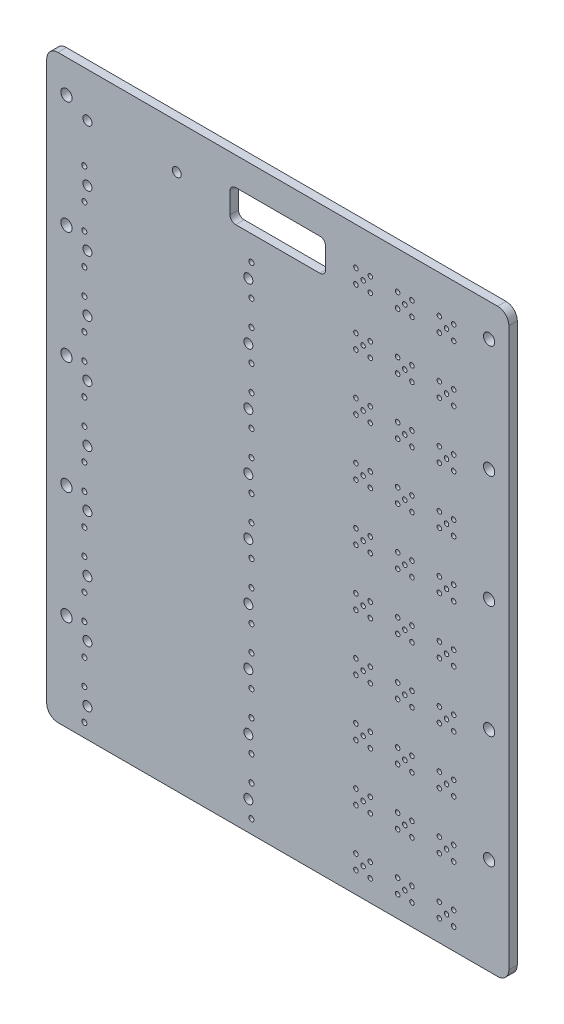
from build123d import *

# Parameters (mm, degrees)
SKETCH2_W                          = 82
SKETCH2_H                          = 103
MAINBOARD_DEPTH                    = 1.5
SKETCH3_W                          = 16.95
SKETCH3_H                          = 5.7
SOLARHOLE_DEPTH                    = 132.663396584
FILLET1_R                          = 2
FILLET2_R                          = 1
F_1_6MM_HOLE_20PIN_D               = 1.6
F_1_6MM_HOLE_20PIN_DEPTH           = 9.525
F_1_6MM_HOLE_20PIN_TIP             = 0.480688495
F_1_6MM_HOLE_40PN_BIG_AT_2_COUNT   = 2
F_1_6MM_HOLE_40PN_BIG_AT_2_PITCH   = 28.55
F_0_9MM_HOLE_40PIN_TINY_AT_2_COUNT = 2
F_0_9MM_HOLE_40PIN_TINY_AT_2_PITCH = 5.5
F_0_9MM_HOLE_40PIN_TINY_AT_3_COUNT = 2
F_0_9MM_HOLE_40PIN_TINY_AT_3_PITCH = 29.65
F_0_9MM_HOLE_40PIN_TINY_AT_4_COUNT = 2
F_0_9MM_HOLE_40PIN_TINY_AT_4_PITCH = 30.155803753
F_0_8MM_MMCX_HOLE_AT_2_COUNT       = 2
F_0_8MM_MMCX_HOLE_AT_2_PITCH       = 1.796051224
F_0_8MM_MMCX_HOLE_AT_3_COUNT       = 2
F_0_8MM_MMCX_HOLE_AT_3_PITCH       = 1.796051224
F_0_8MM_MMCX_HOLE_AT_4_COUNT       = 2
F_0_8MM_MMCX_HOLE_AT_4_PITCH       = 1.796051224
F_0_8MM_MMCX_HOLE_AT_5_COUNT       = 2
F_0_8MM_MMCX_HOLE_AT_5_PITCH       = 1.796051224
MMCX_INTRA_CARD_COUNT              = 3
MMCX_INTRA_CARD_PITCH              = 7.4
ZPOS_BLOCK_COUNT                   = 9
ZPOS_BLOCK_PITCH                   = 10
SCREWHOLES_INTRA_RAIL_COUNT        = 5
SCREWHOLES_INTRA_RAIL_PITCH        = 20


with BuildPart() as part:
    # Sketch2 → mainBoard (new body)
    with BuildSketch(Plane.XY):
        with Locations((41, 51.5)):
            Rectangle(SKETCH2_W, SKETCH2_H)
    extrude(amount=MAINBOARD_DEPTH)

    # Sketch3 → solarHole (cut, through all)
    with BuildSketch(Plane.XY.offset(1.5)):
        with Locations((41, 95.15)):
            Rectangle(SKETCH3_W, SKETCH3_H)
    extrude(amount=-SOLARHOLE_DEPTH, mode=Mode.SUBTRACT)

    # Fillet1
    fillet1_edges = [part.edges().sort_by_distance(p)[0] for p in [
        (0, 0, 0.75),
        (82, 0, 0.75),
        (82, 103, 0.75),
        (0, 103, 0.75),
    ]]
    fillet(fillet1_edges, radius=FILLET1_R)

    # Fillet2
    fillet2_edges = [part.edges().sort_by_distance(p)[0] for p in [
        (49.475, 92.3, 0.75),
        (49.475, 98, 0.75),
        (32.525, 92.3, 0.75),
        (32.525, 98, 0.75),
    ]]
    fillet(fillet2_edges, radius=FILLET2_R)

    # Sketch5 → Ø2.0mm Hole_screw (revolve, cut)
    with BuildSketch(Plane(origin=(3.5, 97.2, 1.5), x_dir=(0, -1, 0), z_dir=(1, 0, 0))):
        Polygon((0, 0), (0, 10.125860619), (1, 9.525), (1, 0), align=None)
    f_2_0mm_hole_screw = revolve(axis=Axis((3.5, 97.2, 7.85), (0, 0, -1)), mode=Mode.SUBTRACT)

    # Ø1.6mm Hole_20pin
    with Locations(Plane.XY.offset(1.5)):
        with Locations((7.225, 95.15), (23.075, 95.15)):
            Hole(F_1_6MM_HOLE_20PIN_D / 2, depth=F_1_6MM_HOLE_20PIN_DEPTH)
            with Locations((0, 0, -(F_1_6MM_HOLE_20PIN_DEPTH + F_1_6MM_HOLE_20PIN_TIP / 2))):  # 118° drill point
                Cone(0, F_1_6MM_HOLE_20PIN_D / 2, F_1_6MM_HOLE_20PIN_TIP, mode=Mode.SUBTRACT)

    # Sketch7 → Ø1.6mm Hole_40pn_big (revolve, cut)
    with BuildSketch(Plane(origin=(7.225, 85.15, 1.5), x_dir=(0, -1, 0), z_dir=(1, 0, 0))):
        Polygon((0, 0), (0, 10.005688495), (0.8, 9.525), (0.8, 0), align=None)
    f_1_6mm_hole_40pn_big = revolve(axis=Axis((7.225, 85.15, 7.85), (0, 0, -1)), mode=Mode.SUBTRACT)

    # Ø1.6mm Hole_40pn_big at 2: Ø1.6mm Hole_40pn_big ×2
    with Locations(*[(i * F_1_6MM_HOLE_40PN_BIG_AT_2_PITCH, 0, 0) for i in range(1, F_1_6MM_HOLE_40PN_BIG_AT_2_COUNT)]):
        add(f_1_6mm_hole_40pn_big, mode=Mode.SUBTRACT)

    # Sketch11 → Ø0.9mm Hole_40pin_tiny (revolve, cut)
    with BuildSketch(Plane(origin=(6.675, 87.9, 1.5), x_dir=(0, -1, 0), z_dir=(1, 0, 0))):
        Polygon((0, 0), (0, 9.795387279), (0.45, 9.525), (0.45, 0), align=None)
    f_0_9mm_hole_40pin_tiny = revolve(axis=Axis((6.675, 87.9, 7.85), (0, 0, -1)), mode=Mode.SUBTRACT)

    # Ø0.9mm Hole_40pin_tiny at 2: Ø0.9mm Hole_40pin_tiny ×2
    with Locations(*[(0, -i * F_0_9MM_HOLE_40PIN_TINY_AT_2_PITCH, 0) for i in range(1, F_0_9MM_HOLE_40PIN_TINY_AT_2_COUNT)]):
        add(f_0_9mm_hole_40pin_tiny, mode=Mode.SUBTRACT)

    # Ø0.9mm Hole_40pin_tiny at 3: Ø0.9mm Hole_40pin_tiny ×2
    with Locations(*[(i * F_0_9MM_HOLE_40PIN_TINY_AT_3_PITCH, 0, 0) for i in range(1, F_0_9MM_HOLE_40PIN_TINY_AT_3_COUNT)]):
        add(f_0_9mm_hole_40pin_tiny, mode=Mode.SUBTRACT)

    # Ø0.9mm Hole_40pin_tiny at 4: Ø0.9mm Hole_40pin_tiny ×2
    with Locations(*[Vector(0.9832269848512432, -0.18238611860646994, 0) * (i * F_0_9MM_HOLE_40PIN_TINY_AT_4_PITCH) for i in range(1, F_0_9MM_HOLE_40PIN_TINY_AT_4_COUNT)]):
        add(f_0_9mm_hole_40pin_tiny, mode=Mode.SUBTRACT)

    # Sketch9 → Ø0.8mm MMCX Hole (revolve, cut)
    with BuildSketch(Plane(origin=(70.94, 85.05, 1.5), x_dir=(0, -1, 0), z_dir=(1, 0, 0))):
        Polygon((0, 0), (0, 9.765344248), (0.4, 9.525), (0.4, 0), align=None)
    f_0_8mm_mmcx_hole = revolve(axis=Axis((70.94, 85.05, 7.85), (0, 0, -1)), mode=Mode.SUBTRACT)

    # Ø0.8mm MMCX Hole at 2: Ø0.8mm MMCX Hole ×2
    with Locations(*[Vector(-0.7071067811865436, 0.7071067811865515, 0) * (i * F_0_8MM_MMCX_HOLE_AT_2_PITCH) for i in range(1, F_0_8MM_MMCX_HOLE_AT_2_COUNT)]):
        add(f_0_8mm_mmcx_hole, mode=Mode.SUBTRACT)

    # Ø0.8mm MMCX Hole at 3: Ø0.8mm MMCX Hole ×2
    with Locations(*[Vector(0.7071067811865476, 0.7071067811865476, 0) * (i * F_0_8MM_MMCX_HOLE_AT_3_PITCH) for i in range(1, F_0_8MM_MMCX_HOLE_AT_3_COUNT)]):
        add(f_0_8mm_mmcx_hole, mode=Mode.SUBTRACT)

    # Ø0.8mm MMCX Hole at 4: Ø0.8mm MMCX Hole ×2
    with Locations(*[Vector(0.7071067811865515, -0.7071067811865436, 0) * (i * F_0_8MM_MMCX_HOLE_AT_4_PITCH) for i in range(1, F_0_8MM_MMCX_HOLE_AT_4_COUNT)]):
        add(f_0_8mm_mmcx_hole, mode=Mode.SUBTRACT)

    # Ø0.8mm MMCX Hole at 5: Ø0.8mm MMCX Hole ×2
    with Locations(*[Vector(-0.7071067811865476, -0.7071067811865476, 0) * (i * F_0_8MM_MMCX_HOLE_AT_5_PITCH) for i in range(1, F_0_8MM_MMCX_HOLE_AT_5_COUNT)]):
        add(f_0_8mm_mmcx_hole, mode=Mode.SUBTRACT)

    # MMCX_intra-card: Ø0.8mm MMCX Hole ×3
    with Locations(*[(-i * MMCX_INTRA_CARD_PITCH, 0, 0) for i in range(1, MMCX_INTRA_CARD_COUNT)]):
        add(f_0_8mm_mmcx_hole, mode=Mode.SUBTRACT)

    # MMCX_intra-card copy 1 sketch → MMCX_intra-card copy 1 (revolve, cut)
    with BuildSketch(Plane(origin=(62.27, 86.32, 1.5), x_dir=(0, -1, 0), z_dir=(1, 0, 0))):
        Polygon((0, 0), (0, 9.765344248), (0.4, 9.525), (0.4, 0), align=None)
    revolve(axis=Axis((62.27, 86.32, 7.85), (0, 0, -1)), mode=Mode.SUBTRACT)

    # MMCX_intra-card copy 2 sketch → MMCX_intra-card copy 2 (revolve, cut)
    with BuildSketch(Plane(origin=(54.87, 86.32, 1.5), x_dir=(0, -1, 0), z_dir=(1, 0, 0))):
        Polygon((0, 0), (0, 9.765344248), (0.4, 9.525), (0.4, 0), align=None)
    revolve(axis=Axis((54.87, 86.32, 7.85), (0, 0, -1)), mode=Mode.SUBTRACT)

    # MMCX_intra-card copy 3 sketch → MMCX_intra-card copy 3 (revolve, cut)
    with BuildSketch(Plane(origin=(64.81, 86.32, 1.5), x_dir=(0, -1, 0), z_dir=(1, 0, 0))):
        Polygon((0, 0), (0, 9.765344248), (0.4, 9.525), (0.4, 0), align=None)
    revolve(axis=Axis((64.81, 86.32, 7.85), (0, 0, -1)), mode=Mode.SUBTRACT)

    # MMCX_intra-card copy 4 sketch → MMCX_intra-card copy 4 (revolve, cut)
    with BuildSketch(Plane(origin=(57.41, 86.32, 1.5), x_dir=(0, -1, 0), z_dir=(1, 0, 0))):
        Polygon((0, 0), (0, 9.765344248), (0.4, 9.525), (0.4, 0), align=None)
    revolve(axis=Axis((57.41, 86.32, 7.85), (0, 0, -1)), mode=Mode.SUBTRACT)

    # MMCX_intra-card copy 5 sketch → MMCX_intra-card copy 5 (revolve, cut)
    with BuildSketch(Plane(origin=(64.81, 83.78, 1.5), x_dir=(0, -1, 0), z_dir=(1, 0, 0))):
        Polygon((0, 0), (0, 9.765344248), (0.4, 9.525), (0.4, 0), align=None)
    revolve(axis=Axis((64.81, 83.78, 7.85), (0, 0, -1)), mode=Mode.SUBTRACT)

    # MMCX_intra-card copy 6 sketch → MMCX_intra-card copy 6 (revolve, cut)
    with BuildSketch(Plane(origin=(57.41, 83.78, 1.5), x_dir=(0, -1, 0), z_dir=(1, 0, 0))):
        Polygon((0, 0), (0, 9.765344248), (0.4, 9.525), (0.4, 0), align=None)
    revolve(axis=Axis((57.41, 83.78, 7.85), (0, 0, -1)), mode=Mode.SUBTRACT)

    # MMCX_intra-card copy 7 sketch → MMCX_intra-card copy 7 (revolve, cut)
    with BuildSketch(Plane(origin=(62.27, 83.78, 1.5), x_dir=(0, -1, 0), z_dir=(1, 0, 0))):
        Polygon((0, 0), (0, 9.765344248), (0.4, 9.525), (0.4, 0), align=None)
    revolve(axis=Axis((62.27, 83.78, 7.85), (0, 0, -1)), mode=Mode.SUBTRACT)

    # MMCX_intra-card copy 8 sketch → MMCX_intra-card copy 8 (revolve, cut)
    with BuildSketch(Plane(origin=(54.87, 83.78, 1.5), x_dir=(0, -1, 0), z_dir=(1, 0, 0))):
        Polygon((0, 0), (0, 9.765344248), (0.4, 9.525), (0.4, 0), align=None)
    revolve(axis=Axis((54.87, 83.78, 7.85), (0, 0, -1)), mode=Mode.SUBTRACT)

    # Zpos_block: Ø1.6mm Hole_40pn_big, Ø0.9mm Hole_40pin_tiny ×9
    with Locations(*[(0, -i * ZPOS_BLOCK_PITCH, 0) for i in range(1, ZPOS_BLOCK_COUNT)]):
        add(f_1_6mm_hole_40pn_big, mode=Mode.SUBTRACT)
        add(f_0_9mm_hole_40pin_tiny, mode=Mode.SUBTRACT)

    # Zpos_block copy 1 sketch → Zpos_block copy 1 (revolve, cut)
    with BuildSketch(Plane(origin=(35.775, 75.15, 1.5), x_dir=(0, -1, 0), z_dir=(1, 0, 0))):
        Polygon((0, 0), (0, 10.005688495), (0.8, 9.525), (0.8, 0), align=None)
    revolve(axis=Axis((35.775, 75.15, 7.85), (0, 0, -1)), mode=Mode.SUBTRACT)

    # Zpos_block copy 2 sketch → Zpos_block copy 2 (revolve, cut)
    with BuildSketch(Plane(origin=(35.775, 65.15, 1.5), x_dir=(0, -1, 0), z_dir=(1, 0, 0))):
        Polygon((0, 0), (0, 10.005688495), (0.8, 9.525), (0.8, 0), align=None)
    revolve(axis=Axis((35.775, 65.15, 7.85), (0, 0, -1)), mode=Mode.SUBTRACT)

    # Zpos_block copy 3 sketch → Zpos_block copy 3 (revolve, cut)
    with BuildSketch(Plane(origin=(35.775, 55.15, 1.5), x_dir=(0, -1, 0), z_dir=(1, 0, 0))):
        Polygon((0, 0), (0, 10.005688495), (0.8, 9.525), (0.8, 0), align=None)
    revolve(axis=Axis((35.775, 55.15, 7.85), (0, 0, -1)), mode=Mode.SUBTRACT)

    # Zpos_block copy 4 sketch → Zpos_block copy 4 (revolve, cut)
    with BuildSketch(Plane(origin=(35.775, 45.15, 1.5), x_dir=(0, -1, 0), z_dir=(1, 0, 0))):
        Polygon((0, 0), (0, 10.005688495), (0.8, 9.525), (0.8, 0), align=None)
    revolve(axis=Axis((35.775, 45.15, 7.85), (0, 0, -1)), mode=Mode.SUBTRACT)

    # Zpos_block copy 5 sketch → Zpos_block copy 5 (revolve, cut)
    with BuildSketch(Plane(origin=(35.775, 35.15, 1.5), x_dir=(0, -1, 0), z_dir=(1, 0, 0))):
        Polygon((0, 0), (0, 10.005688495), (0.8, 9.525), (0.8, 0), align=None)
    revolve(axis=Axis((35.775, 35.15, 7.85), (0, 0, -1)), mode=Mode.SUBTRACT)

    # Zpos_block copy 6 sketch → Zpos_block copy 6 (revolve, cut)
    with BuildSketch(Plane(origin=(35.775, 25.15, 1.5), x_dir=(0, -1, 0), z_dir=(1, 0, 0))):
        Polygon((0, 0), (0, 10.005688495), (0.8, 9.525), (0.8, 0), align=None)
    revolve(axis=Axis((35.775, 25.15, 7.85), (0, 0, -1)), mode=Mode.SUBTRACT)

    # Zpos_block copy 7 sketch → Zpos_block copy 7 (revolve, cut)
    with BuildSketch(Plane(origin=(35.775, 15.15, 1.5), x_dir=(0, -1, 0), z_dir=(1, 0, 0))):
        Polygon((0, 0), (0, 10.005688495), (0.8, 9.525), (0.8, 0), align=None)
    revolve(axis=Axis((35.775, 15.15, 7.85), (0, 0, -1)), mode=Mode.SUBTRACT)

    # Zpos_block copy 8 sketch → Zpos_block copy 8 (revolve, cut)
    with BuildSketch(Plane(origin=(35.775, 5.15, 1.5), x_dir=(0, -1, 0), z_dir=(1, 0, 0))):
        Polygon((0, 0), (0, 10.005688495), (0.8, 9.525), (0.8, 0), align=None)
    revolve(axis=Axis((35.775, 5.15, 7.85), (0, 0, -1)), mode=Mode.SUBTRACT)

    # Zpos_block copy 9 sketch → Zpos_block copy 9 (revolve, cut)
    with BuildSketch(Plane(origin=(6.675, 72.4, 1.5), x_dir=(0, -1, 0), z_dir=(1, 0, 0))):
        Polygon((0, 0), (0, 9.795387279), (0.45, 9.525), (0.45, 0), align=None)
    revolve(axis=Axis((6.675, 72.4, 7.85), (0, 0, -1)), mode=Mode.SUBTRACT)

    # Zpos_block copy 10 sketch → Zpos_block copy 10 (revolve, cut)
    with BuildSketch(Plane(origin=(6.675, 62.4, 1.5), x_dir=(0, -1, 0), z_dir=(1, 0, 0))):
        Polygon((0, 0), (0, 9.795387279), (0.45, 9.525), (0.45, 0), align=None)
    revolve(axis=Axis((6.675, 62.4, 7.85), (0, 0, -1)), mode=Mode.SUBTRACT)

    # Zpos_block copy 11 sketch → Zpos_block copy 11 (revolve, cut)
    with BuildSketch(Plane(origin=(6.675, 52.4, 1.5), x_dir=(0, -1, 0), z_dir=(1, 0, 0))):
        Polygon((0, 0), (0, 9.795387279), (0.45, 9.525), (0.45, 0), align=None)
    revolve(axis=Axis((6.675, 52.4, 7.85), (0, 0, -1)), mode=Mode.SUBTRACT)

    # Zpos_block copy 12 sketch → Zpos_block copy 12 (revolve, cut)
    with BuildSketch(Plane(origin=(6.675, 42.4, 1.5), x_dir=(0, -1, 0), z_dir=(1, 0, 0))):
        Polygon((0, 0), (0, 9.795387279), (0.45, 9.525), (0.45, 0), align=None)
    revolve(axis=Axis((6.675, 42.4, 7.85), (0, 0, -1)), mode=Mode.SUBTRACT)

    # Zpos_block copy 13 sketch → Zpos_block copy 13 (revolve, cut)
    with BuildSketch(Plane(origin=(6.675, 32.4, 1.5), x_dir=(0, -1, 0), z_dir=(1, 0, 0))):
        Polygon((0, 0), (0, 9.795387279), (0.45, 9.525), (0.45, 0), align=None)
    revolve(axis=Axis((6.675, 32.4, 7.85), (0, 0, -1)), mode=Mode.SUBTRACT)

    # Zpos_block copy 14 sketch → Zpos_block copy 14 (revolve, cut)
    with BuildSketch(Plane(origin=(6.675, 22.4, 1.5), x_dir=(0, -1, 0), z_dir=(1, 0, 0))):
        Polygon((0, 0), (0, 9.795387279), (0.45, 9.525), (0.45, 0), align=None)
    revolve(axis=Axis((6.675, 22.4, 7.85), (0, 0, -1)), mode=Mode.SUBTRACT)

    # Zpos_block copy 15 sketch → Zpos_block copy 15 (revolve, cut)
    with BuildSketch(Plane(origin=(6.675, 12.4, 1.5), x_dir=(0, -1, 0), z_dir=(1, 0, 0))):
        Polygon((0, 0), (0, 9.795387279), (0.45, 9.525), (0.45, 0), align=None)
    revolve(axis=Axis((6.675, 12.4, 7.85), (0, 0, -1)), mode=Mode.SUBTRACT)

    # Zpos_block copy 16 sketch → Zpos_block copy 16 (revolve, cut)
    with BuildSketch(Plane(origin=(6.675, 2.4, 1.5), x_dir=(0, -1, 0), z_dir=(1, 0, 0))):
        Polygon((0, 0), (0, 9.795387279), (0.45, 9.525), (0.45, 0), align=None)
    revolve(axis=Axis((6.675, 2.4, 7.85), (0, 0, -1)), mode=Mode.SUBTRACT)

    # Zpos_block copy 17 sketch → Zpos_block copy 17 (revolve, cut)
    with BuildSketch(Plane(origin=(36.325, 77.9, 1.5), x_dir=(0, -1, 0), z_dir=(1, 0, 0))):
        Polygon((0, 0), (0, 9.795387279), (0.45, 9.525), (0.45, 0), align=None)
    revolve(axis=Axis((36.325, 77.9, 7.85), (0, 0, -1)), mode=Mode.SUBTRACT)

    # Zpos_block copy 18 sketch → Zpos_block copy 18 (revolve, cut)
    with BuildSketch(Plane(origin=(36.325, 67.9, 1.5), x_dir=(0, -1, 0), z_dir=(1, 0, 0))):
        Polygon((0, 0), (0, 9.795387279), (0.45, 9.525), (0.45, 0), align=None)
    revolve(axis=Axis((36.325, 67.9, 7.85), (0, 0, -1)), mode=Mode.SUBTRACT)

    # Zpos_block copy 19 sketch → Zpos_block copy 19 (revolve, cut)
    with BuildSketch(Plane(origin=(36.325, 57.9, 1.5), x_dir=(0, -1, 0), z_dir=(1, 0, 0))):
        Polygon((0, 0), (0, 9.795387279), (0.45, 9.525), (0.45, 0), align=None)
    revolve(axis=Axis((36.325, 57.9, 7.85), (0, 0, -1)), mode=Mode.SUBTRACT)

    # Zpos_block copy 20 sketch → Zpos_block copy 20 (revolve, cut)
    with BuildSketch(Plane(origin=(36.325, 47.9, 1.5), x_dir=(0, -1, 0), z_dir=(1, 0, 0))):
        Polygon((0, 0), (0, 9.795387279), (0.45, 9.525), (0.45, 0), align=None)
    revolve(axis=Axis((36.325, 47.9, 7.85), (0, 0, -1)), mode=Mode.SUBTRACT)

    # Zpos_block copy 21 sketch → Zpos_block copy 21 (revolve, cut)
    with BuildSketch(Plane(origin=(36.325, 37.9, 1.5), x_dir=(0, -1, 0), z_dir=(1, 0, 0))):
        Polygon((0, 0), (0, 9.795387279), (0.45, 9.525), (0.45, 0), align=None)
    revolve(axis=Axis((36.325, 37.9, 7.85), (0, 0, -1)), mode=Mode.SUBTRACT)

    # Zpos_block copy 22 sketch → Zpos_block copy 22 (revolve, cut)
    with BuildSketch(Plane(origin=(36.325, 27.9, 1.5), x_dir=(0, -1, 0), z_dir=(1, 0, 0))):
        Polygon((0, 0), (0, 9.795387279), (0.45, 9.525), (0.45, 0), align=None)
    revolve(axis=Axis((36.325, 27.9, 7.85), (0, 0, -1)), mode=Mode.SUBTRACT)

    # Zpos_block copy 23 sketch → Zpos_block copy 23 (revolve, cut)
    with BuildSketch(Plane(origin=(36.325, 17.9, 1.5), x_dir=(0, -1, 0), z_dir=(1, 0, 0))):
        Polygon((0, 0), (0, 9.795387279), (0.45, 9.525), (0.45, 0), align=None)
    revolve(axis=Axis((36.325, 17.9, 7.85), (0, 0, -1)), mode=Mode.SUBTRACT)

    # Zpos_block copy 24 sketch → Zpos_block copy 24 (revolve, cut)
    with BuildSketch(Plane(origin=(36.325, 7.9, 1.5), x_dir=(0, -1, 0), z_dir=(1, 0, 0))):
        Polygon((0, 0), (0, 9.795387279), (0.45, 9.525), (0.45, 0), align=None)
    revolve(axis=Axis((36.325, 7.9, 7.85), (0, 0, -1)), mode=Mode.SUBTRACT)

    # Zpos_block copy 25 sketch → Zpos_block copy 25 (revolve, cut)
    with BuildSketch(Plane(origin=(36.325, 72.4, 1.5), x_dir=(0, -1, 0), z_dir=(1, 0, 0))):
        Polygon((0, 0), (0, 9.795387279), (0.45, 9.525), (0.45, 0), align=None)
    revolve(axis=Axis((36.325, 72.4, 7.85), (0, 0, -1)), mode=Mode.SUBTRACT)

    # Zpos_block copy 26 sketch → Zpos_block copy 26 (revolve, cut)
    with BuildSketch(Plane(origin=(36.325, 62.4, 1.5), x_dir=(0, -1, 0), z_dir=(1, 0, 0))):
        Polygon((0, 0), (0, 9.795387279), (0.45, 9.525), (0.45, 0), align=None)
    revolve(axis=Axis((36.325, 62.4, 7.85), (0, 0, -1)), mode=Mode.SUBTRACT)

    # Zpos_block copy 27 sketch → Zpos_block copy 27 (revolve, cut)
    with BuildSketch(Plane(origin=(36.325, 52.4, 1.5), x_dir=(0, -1, 0), z_dir=(1, 0, 0))):
        Polygon((0, 0), (0, 9.795387279), (0.45, 9.525), (0.45, 0), align=None)
    revolve(axis=Axis((36.325, 52.4, 7.85), (0, 0, -1)), mode=Mode.SUBTRACT)

    # Zpos_block copy 28 sketch → Zpos_block copy 28 (revolve, cut)
    with BuildSketch(Plane(origin=(36.325, 42.4, 1.5), x_dir=(0, -1, 0), z_dir=(1, 0, 0))):
        Polygon((0, 0), (0, 9.795387279), (0.45, 9.525), (0.45, 0), align=None)
    revolve(axis=Axis((36.325, 42.4, 7.85), (0, 0, -1)), mode=Mode.SUBTRACT)

    # Zpos_block copy 29 sketch → Zpos_block copy 29 (revolve, cut)
    with BuildSketch(Plane(origin=(36.325, 32.4, 1.5), x_dir=(0, -1, 0), z_dir=(1, 0, 0))):
        Polygon((0, 0), (0, 9.795387279), (0.45, 9.525), (0.45, 0), align=None)
    revolve(axis=Axis((36.325, 32.4, 7.85), (0, 0, -1)), mode=Mode.SUBTRACT)

    # Zpos_block copy 30 sketch → Zpos_block copy 30 (revolve, cut)
    with BuildSketch(Plane(origin=(36.325, 22.4, 1.5), x_dir=(0, -1, 0), z_dir=(1, 0, 0))):
        Polygon((0, 0), (0, 9.795387279), (0.45, 9.525), (0.45, 0), align=None)
    revolve(axis=Axis((36.325, 22.4, 7.85), (0, 0, -1)), mode=Mode.SUBTRACT)

    # Zpos_block copy 31 sketch → Zpos_block copy 31 (revolve, cut)
    with BuildSketch(Plane(origin=(36.325, 12.4, 1.5), x_dir=(0, -1, 0), z_dir=(1, 0, 0))):
        Polygon((0, 0), (0, 9.795387279), (0.45, 9.525), (0.45, 0), align=None)
    revolve(axis=Axis((36.325, 12.4, 7.85), (0, 0, -1)), mode=Mode.SUBTRACT)

    # Zpos_block copy 32 sketch → Zpos_block copy 32 (revolve, cut)
    with BuildSketch(Plane(origin=(36.325, 2.4, 1.5), x_dir=(0, -1, 0), z_dir=(1, 0, 0))):
        Polygon((0, 0), (0, 9.795387279), (0.45, 9.525), (0.45, 0), align=None)
    revolve(axis=Axis((36.325, 2.4, 7.85), (0, 0, -1)), mode=Mode.SUBTRACT)

    # Zpos_block copy 33 sketch → Zpos_block copy 33 (revolve, cut)
    with BuildSketch(Plane(origin=(63.54, 75.05, 1.5), x_dir=(0, -1, 0), z_dir=(1, 0, 0))):
        Polygon((0, 0), (0, 9.765344248), (0.4, 9.525), (0.4, 0), align=None)
    revolve(axis=Axis((63.54, 75.05, 7.85), (0, 0, -1)), mode=Mode.SUBTRACT)

    # Zpos_block copy 34 sketch → Zpos_block copy 34 (revolve, cut)
    with BuildSketch(Plane(origin=(63.54, 65.05, 1.5), x_dir=(0, -1, 0), z_dir=(1, 0, 0))):
        Polygon((0, 0), (0, 9.765344248), (0.4, 9.525), (0.4, 0), align=None)
    revolve(axis=Axis((63.54, 65.05, 7.85), (0, 0, -1)), mode=Mode.SUBTRACT)

    # Zpos_block copy 35 sketch → Zpos_block copy 35 (revolve, cut)
    with BuildSketch(Plane(origin=(63.54, 55.05, 1.5), x_dir=(0, -1, 0), z_dir=(1, 0, 0))):
        Polygon((0, 0), (0, 9.765344248), (0.4, 9.525), (0.4, 0), align=None)
    revolve(axis=Axis((63.54, 55.05, 7.85), (0, 0, -1)), mode=Mode.SUBTRACT)

    # Zpos_block copy 36 sketch → Zpos_block copy 36 (revolve, cut)
    with BuildSketch(Plane(origin=(63.54, 45.05, 1.5), x_dir=(0, -1, 0), z_dir=(1, 0, 0))):
        Polygon((0, 0), (0, 9.765344248), (0.4, 9.525), (0.4, 0), align=None)
    revolve(axis=Axis((63.54, 45.05, 7.85), (0, 0, -1)), mode=Mode.SUBTRACT)

    # Zpos_block copy 37 sketch → Zpos_block copy 37 (revolve, cut)
    with BuildSketch(Plane(origin=(63.54, 35.05, 1.5), x_dir=(0, -1, 0), z_dir=(1, 0, 0))):
        Polygon((0, 0), (0, 9.765344248), (0.4, 9.525), (0.4, 0), align=None)
    revolve(axis=Axis((63.54, 35.05, 7.85), (0, 0, -1)), mode=Mode.SUBTRACT)

    # Zpos_block copy 38 sketch → Zpos_block copy 38 (revolve, cut)
    with BuildSketch(Plane(origin=(63.54, 25.05, 1.5), x_dir=(0, -1, 0), z_dir=(1, 0, 0))):
        Polygon((0, 0), (0, 9.765344248), (0.4, 9.525), (0.4, 0), align=None)
    revolve(axis=Axis((63.54, 25.05, 7.85), (0, 0, -1)), mode=Mode.SUBTRACT)

    # Zpos_block copy 39 sketch → Zpos_block copy 39 (revolve, cut)
    with BuildSketch(Plane(origin=(63.54, 15.05, 1.5), x_dir=(0, -1, 0), z_dir=(1, 0, 0))):
        Polygon((0, 0), (0, 9.765344248), (0.4, 9.525), (0.4, 0), align=None)
    revolve(axis=Axis((63.54, 15.05, 7.85), (0, 0, -1)), mode=Mode.SUBTRACT)

    # Zpos_block copy 40 sketch → Zpos_block copy 40 (revolve, cut)
    with BuildSketch(Plane(origin=(63.54, 5.05, 1.5), x_dir=(0, -1, 0), z_dir=(1, 0, 0))):
        Polygon((0, 0), (0, 9.765344248), (0.4, 9.525), (0.4, 0), align=None)
    revolve(axis=Axis((63.54, 5.05, 7.85), (0, 0, -1)), mode=Mode.SUBTRACT)

    # Zpos_block copy 41 sketch → Zpos_block copy 41 (revolve, cut)
    with BuildSketch(Plane(origin=(56.14, 75.05, 1.5), x_dir=(0, -1, 0), z_dir=(1, 0, 0))):
        Polygon((0, 0), (0, 9.765344248), (0.4, 9.525), (0.4, 0), align=None)
    revolve(axis=Axis((56.14, 75.05, 7.85), (0, 0, -1)), mode=Mode.SUBTRACT)

    # Zpos_block copy 42 sketch → Zpos_block copy 42 (revolve, cut)
    with BuildSketch(Plane(origin=(56.14, 65.05, 1.5), x_dir=(0, -1, 0), z_dir=(1, 0, 0))):
        Polygon((0, 0), (0, 9.765344248), (0.4, 9.525), (0.4, 0), align=None)
    revolve(axis=Axis((56.14, 65.05, 7.85), (0, 0, -1)), mode=Mode.SUBTRACT)

    # Zpos_block copy 43 sketch → Zpos_block copy 43 (revolve, cut)
    with BuildSketch(Plane(origin=(56.14, 55.05, 1.5), x_dir=(0, -1, 0), z_dir=(1, 0, 0))):
        Polygon((0, 0), (0, 9.765344248), (0.4, 9.525), (0.4, 0), align=None)
    revolve(axis=Axis((56.14, 55.05, 7.85), (0, 0, -1)), mode=Mode.SUBTRACT)

    # Zpos_block copy 44 sketch → Zpos_block copy 44 (revolve, cut)
    with BuildSketch(Plane(origin=(56.14, 45.05, 1.5), x_dir=(0, -1, 0), z_dir=(1, 0, 0))):
        Polygon((0, 0), (0, 9.765344248), (0.4, 9.525), (0.4, 0), align=None)
    revolve(axis=Axis((56.14, 45.05, 7.85), (0, 0, -1)), mode=Mode.SUBTRACT)

    # Zpos_block copy 45 sketch → Zpos_block copy 45 (revolve, cut)
    with BuildSketch(Plane(origin=(56.14, 35.05, 1.5), x_dir=(0, -1, 0), z_dir=(1, 0, 0))):
        Polygon((0, 0), (0, 9.765344248), (0.4, 9.525), (0.4, 0), align=None)
    revolve(axis=Axis((56.14, 35.05, 7.85), (0, 0, -1)), mode=Mode.SUBTRACT)

    # Zpos_block copy 46 sketch → Zpos_block copy 46 (revolve, cut)
    with BuildSketch(Plane(origin=(56.14, 25.05, 1.5), x_dir=(0, -1, 0), z_dir=(1, 0, 0))):
        Polygon((0, 0), (0, 9.765344248), (0.4, 9.525), (0.4, 0), align=None)
    revolve(axis=Axis((56.14, 25.05, 7.85), (0, 0, -1)), mode=Mode.SUBTRACT)

    # Zpos_block copy 47 sketch → Zpos_block copy 47 (revolve, cut)
    with BuildSketch(Plane(origin=(56.14, 15.05, 1.5), x_dir=(0, -1, 0), z_dir=(1, 0, 0))):
        Polygon((0, 0), (0, 9.765344248), (0.4, 9.525), (0.4, 0), align=None)
    revolve(axis=Axis((56.14, 15.05, 7.85), (0, 0, -1)), mode=Mode.SUBTRACT)

    # Zpos_block copy 48 sketch → Zpos_block copy 48 (revolve, cut)
    with BuildSketch(Plane(origin=(56.14, 5.05, 1.5), x_dir=(0, -1, 0), z_dir=(1, 0, 0))):
        Polygon((0, 0), (0, 9.765344248), (0.4, 9.525), (0.4, 0), align=None)
    revolve(axis=Axis((56.14, 5.05, 7.85), (0, 0, -1)), mode=Mode.SUBTRACT)

    # Zpos_block copy 49 sketch → Zpos_block copy 49 (revolve, cut)
    with BuildSketch(Plane(origin=(62.27, 76.32, 1.5), x_dir=(0, -1, 0), z_dir=(1, 0, 0))):
        Polygon((0, 0), (0, 9.765344248), (0.4, 9.525), (0.4, 0), align=None)
    revolve(axis=Axis((62.27, 76.32, 7.85), (0, 0, -1)), mode=Mode.SUBTRACT)

    # Zpos_block copy 50 sketch → Zpos_block copy 50 (revolve, cut)
    with BuildSketch(Plane(origin=(62.27, 66.32, 1.5), x_dir=(0, -1, 0), z_dir=(1, 0, 0))):
        Polygon((0, 0), (0, 9.765344248), (0.4, 9.525), (0.4, 0), align=None)
    revolve(axis=Axis((62.27, 66.32, 7.85), (0, 0, -1)), mode=Mode.SUBTRACT)

    # Zpos_block copy 51 sketch → Zpos_block copy 51 (revolve, cut)
    with BuildSketch(Plane(origin=(62.27, 56.32, 1.5), x_dir=(0, -1, 0), z_dir=(1, 0, 0))):
        Polygon((0, 0), (0, 9.765344248), (0.4, 9.525), (0.4, 0), align=None)
    revolve(axis=Axis((62.27, 56.32, 7.85), (0, 0, -1)), mode=Mode.SUBTRACT)

    # Zpos_block copy 52 sketch → Zpos_block copy 52 (revolve, cut)
    with BuildSketch(Plane(origin=(62.27, 46.32, 1.5), x_dir=(0, -1, 0), z_dir=(1, 0, 0))):
        Polygon((0, 0), (0, 9.765344248), (0.4, 9.525), (0.4, 0), align=None)
    revolve(axis=Axis((62.27, 46.32, 7.85), (0, 0, -1)), mode=Mode.SUBTRACT)

    # Zpos_block copy 53 sketch → Zpos_block copy 53 (revolve, cut)
    with BuildSketch(Plane(origin=(62.27, 36.32, 1.5), x_dir=(0, -1, 0), z_dir=(1, 0, 0))):
        Polygon((0, 0), (0, 9.765344248), (0.4, 9.525), (0.4, 0), align=None)
    revolve(axis=Axis((62.27, 36.32, 7.85), (0, 0, -1)), mode=Mode.SUBTRACT)

    # Zpos_block copy 54 sketch → Zpos_block copy 54 (revolve, cut)
    with BuildSketch(Plane(origin=(62.27, 26.32, 1.5), x_dir=(0, -1, 0), z_dir=(1, 0, 0))):
        Polygon((0, 0), (0, 9.765344248), (0.4, 9.525), (0.4, 0), align=None)
    revolve(axis=Axis((62.27, 26.32, 7.85), (0, 0, -1)), mode=Mode.SUBTRACT)

    # Zpos_block copy 55 sketch → Zpos_block copy 55 (revolve, cut)
    with BuildSketch(Plane(origin=(62.27, 16.32, 1.5), x_dir=(0, -1, 0), z_dir=(1, 0, 0))):
        Polygon((0, 0), (0, 9.765344248), (0.4, 9.525), (0.4, 0), align=None)
    revolve(axis=Axis((62.27, 16.32, 7.85), (0, 0, -1)), mode=Mode.SUBTRACT)

    # Zpos_block copy 56 sketch → Zpos_block copy 56 (revolve, cut)
    with BuildSketch(Plane(origin=(62.27, 6.32, 1.5), x_dir=(0, -1, 0), z_dir=(1, 0, 0))):
        Polygon((0, 0), (0, 9.765344248), (0.4, 9.525), (0.4, 0), align=None)
    revolve(axis=Axis((62.27, 6.32, 7.85), (0, 0, -1)), mode=Mode.SUBTRACT)

    # Zpos_block copy 57 sketch → Zpos_block copy 57 (revolve, cut)
    with BuildSketch(Plane(origin=(54.87, 76.32, 1.5), x_dir=(0, -1, 0), z_dir=(1, 0, 0))):
        Polygon((0, 0), (0, 9.765344248), (0.4, 9.525), (0.4, 0), align=None)
    revolve(axis=Axis((54.87, 76.32, 7.85), (0, 0, -1)), mode=Mode.SUBTRACT)

    # Zpos_block copy 58 sketch → Zpos_block copy 58 (revolve, cut)
    with BuildSketch(Plane(origin=(54.87, 66.32, 1.5), x_dir=(0, -1, 0), z_dir=(1, 0, 0))):
        Polygon((0, 0), (0, 9.765344248), (0.4, 9.525), (0.4, 0), align=None)
    revolve(axis=Axis((54.87, 66.32, 7.85), (0, 0, -1)), mode=Mode.SUBTRACT)

    # Zpos_block copy 59 sketch → Zpos_block copy 59 (revolve, cut)
    with BuildSketch(Plane(origin=(54.87, 56.32, 1.5), x_dir=(0, -1, 0), z_dir=(1, 0, 0))):
        Polygon((0, 0), (0, 9.765344248), (0.4, 9.525), (0.4, 0), align=None)
    revolve(axis=Axis((54.87, 56.32, 7.85), (0, 0, -1)), mode=Mode.SUBTRACT)

    # Zpos_block copy 60 sketch → Zpos_block copy 60 (revolve, cut)
    with BuildSketch(Plane(origin=(54.87, 46.32, 1.5), x_dir=(0, -1, 0), z_dir=(1, 0, 0))):
        Polygon((0, 0), (0, 9.765344248), (0.4, 9.525), (0.4, 0), align=None)
    revolve(axis=Axis((54.87, 46.32, 7.85), (0, 0, -1)), mode=Mode.SUBTRACT)

    # Zpos_block copy 61 sketch → Zpos_block copy 61 (revolve, cut)
    with BuildSketch(Plane(origin=(54.87, 36.32, 1.5), x_dir=(0, -1, 0), z_dir=(1, 0, 0))):
        Polygon((0, 0), (0, 9.765344248), (0.4, 9.525), (0.4, 0), align=None)
    revolve(axis=Axis((54.87, 36.32, 7.85), (0, 0, -1)), mode=Mode.SUBTRACT)

    # Zpos_block copy 62 sketch → Zpos_block copy 62 (revolve, cut)
    with BuildSketch(Plane(origin=(54.87, 26.32, 1.5), x_dir=(0, -1, 0), z_dir=(1, 0, 0))):
        Polygon((0, 0), (0, 9.765344248), (0.4, 9.525), (0.4, 0), align=None)
    revolve(axis=Axis((54.87, 26.32, 7.85), (0, 0, -1)), mode=Mode.SUBTRACT)

    # Zpos_block copy 63 sketch → Zpos_block copy 63 (revolve, cut)
    with BuildSketch(Plane(origin=(54.87, 16.32, 1.5), x_dir=(0, -1, 0), z_dir=(1, 0, 0))):
        Polygon((0, 0), (0, 9.765344248), (0.4, 9.525), (0.4, 0), align=None)
    revolve(axis=Axis((54.87, 16.32, 7.85), (0, 0, -1)), mode=Mode.SUBTRACT)

    # Zpos_block copy 64 sketch → Zpos_block copy 64 (revolve, cut)
    with BuildSketch(Plane(origin=(54.87, 6.32, 1.5), x_dir=(0, -1, 0), z_dir=(1, 0, 0))):
        Polygon((0, 0), (0, 9.765344248), (0.4, 9.525), (0.4, 0), align=None)
    revolve(axis=Axis((54.87, 6.32, 7.85), (0, 0, -1)), mode=Mode.SUBTRACT)

    # Zpos_block copy 65 sketch → Zpos_block copy 65 (revolve, cut)
    with BuildSketch(Plane(origin=(64.81, 76.32, 1.5), x_dir=(0, -1, 0), z_dir=(1, 0, 0))):
        Polygon((0, 0), (0, 9.765344248), (0.4, 9.525), (0.4, 0), align=None)
    revolve(axis=Axis((64.81, 76.32, 7.85), (0, 0, -1)), mode=Mode.SUBTRACT)

    # Zpos_block copy 66 sketch → Zpos_block copy 66 (revolve, cut)
    with BuildSketch(Plane(origin=(64.81, 66.32, 1.5), x_dir=(0, -1, 0), z_dir=(1, 0, 0))):
        Polygon((0, 0), (0, 9.765344248), (0.4, 9.525), (0.4, 0), align=None)
    revolve(axis=Axis((64.81, 66.32, 7.85), (0, 0, -1)), mode=Mode.SUBTRACT)

    # Zpos_block copy 67 sketch → Zpos_block copy 67 (revolve, cut)
    with BuildSketch(Plane(origin=(64.81, 56.32, 1.5), x_dir=(0, -1, 0), z_dir=(1, 0, 0))):
        Polygon((0, 0), (0, 9.765344248), (0.4, 9.525), (0.4, 0), align=None)
    revolve(axis=Axis((64.81, 56.32, 7.85), (0, 0, -1)), mode=Mode.SUBTRACT)

    # Zpos_block copy 68 sketch → Zpos_block copy 68 (revolve, cut)
    with BuildSketch(Plane(origin=(64.81, 46.32, 1.5), x_dir=(0, -1, 0), z_dir=(1, 0, 0))):
        Polygon((0, 0), (0, 9.765344248), (0.4, 9.525), (0.4, 0), align=None)
    revolve(axis=Axis((64.81, 46.32, 7.85), (0, 0, -1)), mode=Mode.SUBTRACT)

    # Zpos_block copy 69 sketch → Zpos_block copy 69 (revolve, cut)
    with BuildSketch(Plane(origin=(64.81, 36.32, 1.5), x_dir=(0, -1, 0), z_dir=(1, 0, 0))):
        Polygon((0, 0), (0, 9.765344248), (0.4, 9.525), (0.4, 0), align=None)
    revolve(axis=Axis((64.81, 36.32, 7.85), (0, 0, -1)), mode=Mode.SUBTRACT)

    # Zpos_block copy 70 sketch → Zpos_block copy 70 (revolve, cut)
    with BuildSketch(Plane(origin=(64.81, 26.32, 1.5), x_dir=(0, -1, 0), z_dir=(1, 0, 0))):
        Polygon((0, 0), (0, 9.765344248), (0.4, 9.525), (0.4, 0), align=None)
    revolve(axis=Axis((64.81, 26.32, 7.85), (0, 0, -1)), mode=Mode.SUBTRACT)

    # Zpos_block copy 71 sketch → Zpos_block copy 71 (revolve, cut)
    with BuildSketch(Plane(origin=(64.81, 16.32, 1.5), x_dir=(0, -1, 0), z_dir=(1, 0, 0))):
        Polygon((0, 0), (0, 9.765344248), (0.4, 9.525), (0.4, 0), align=None)
    revolve(axis=Axis((64.81, 16.32, 7.85), (0, 0, -1)), mode=Mode.SUBTRACT)

    # Zpos_block copy 72 sketch → Zpos_block copy 72 (revolve, cut)
    with BuildSketch(Plane(origin=(64.81, 6.32, 1.5), x_dir=(0, -1, 0), z_dir=(1, 0, 0))):
        Polygon((0, 0), (0, 9.765344248), (0.4, 9.525), (0.4, 0), align=None)
    revolve(axis=Axis((64.81, 6.32, 7.85), (0, 0, -1)), mode=Mode.SUBTRACT)

    # Zpos_block copy 73 sketch → Zpos_block copy 73 (revolve, cut)
    with BuildSketch(Plane(origin=(57.41, 76.32, 1.5), x_dir=(0, -1, 0), z_dir=(1, 0, 0))):
        Polygon((0, 0), (0, 9.765344248), (0.4, 9.525), (0.4, 0), align=None)
    revolve(axis=Axis((57.41, 76.32, 7.85), (0, 0, -1)), mode=Mode.SUBTRACT)

    # Zpos_block copy 74 sketch → Zpos_block copy 74 (revolve, cut)
    with BuildSketch(Plane(origin=(57.41, 66.32, 1.5), x_dir=(0, -1, 0), z_dir=(1, 0, 0))):
        Polygon((0, 0), (0, 9.765344248), (0.4, 9.525), (0.4, 0), align=None)
    revolve(axis=Axis((57.41, 66.32, 7.85), (0, 0, -1)), mode=Mode.SUBTRACT)

    # Zpos_block copy 75 sketch → Zpos_block copy 75 (revolve, cut)
    with BuildSketch(Plane(origin=(57.41, 56.32, 1.5), x_dir=(0, -1, 0), z_dir=(1, 0, 0))):
        Polygon((0, 0), (0, 9.765344248), (0.4, 9.525), (0.4, 0), align=None)
    revolve(axis=Axis((57.41, 56.32, 7.85), (0, 0, -1)), mode=Mode.SUBTRACT)

    # Zpos_block copy 76 sketch → Zpos_block copy 76 (revolve, cut)
    with BuildSketch(Plane(origin=(57.41, 46.32, 1.5), x_dir=(0, -1, 0), z_dir=(1, 0, 0))):
        Polygon((0, 0), (0, 9.765344248), (0.4, 9.525), (0.4, 0), align=None)
    revolve(axis=Axis((57.41, 46.32, 7.85), (0, 0, -1)), mode=Mode.SUBTRACT)

    # Zpos_block copy 77 sketch → Zpos_block copy 77 (revolve, cut)
    with BuildSketch(Plane(origin=(57.41, 36.32, 1.5), x_dir=(0, -1, 0), z_dir=(1, 0, 0))):
        Polygon((0, 0), (0, 9.765344248), (0.4, 9.525), (0.4, 0), align=None)
    revolve(axis=Axis((57.41, 36.32, 7.85), (0, 0, -1)), mode=Mode.SUBTRACT)

    # Zpos_block copy 78 sketch → Zpos_block copy 78 (revolve, cut)
    with BuildSketch(Plane(origin=(57.41, 26.32, 1.5), x_dir=(0, -1, 0), z_dir=(1, 0, 0))):
        Polygon((0, 0), (0, 9.765344248), (0.4, 9.525), (0.4, 0), align=None)
    revolve(axis=Axis((57.41, 26.32, 7.85), (0, 0, -1)), mode=Mode.SUBTRACT)

    # Zpos_block copy 79 sketch → Zpos_block copy 79 (revolve, cut)
    with BuildSketch(Plane(origin=(57.41, 16.32, 1.5), x_dir=(0, -1, 0), z_dir=(1, 0, 0))):
        Polygon((0, 0), (0, 9.765344248), (0.4, 9.525), (0.4, 0), align=None)
    revolve(axis=Axis((57.41, 16.32, 7.85), (0, 0, -1)), mode=Mode.SUBTRACT)

    # Zpos_block copy 80 sketch → Zpos_block copy 80 (revolve, cut)
    with BuildSketch(Plane(origin=(57.41, 6.32, 1.5), x_dir=(0, -1, 0), z_dir=(1, 0, 0))):
        Polygon((0, 0), (0, 9.765344248), (0.4, 9.525), (0.4, 0), align=None)
    revolve(axis=Axis((57.41, 6.32, 7.85), (0, 0, -1)), mode=Mode.SUBTRACT)

    # Zpos_block copy 81 sketch → Zpos_block copy 81 (revolve, cut)
    with BuildSketch(Plane(origin=(64.81, 73.78, 1.5), x_dir=(0, -1, 0), z_dir=(1, 0, 0))):
        Polygon((0, 0), (0, 9.765344248), (0.4, 9.525), (0.4, 0), align=None)
    revolve(axis=Axis((64.81, 73.78, 7.85), (0, 0, -1)), mode=Mode.SUBTRACT)

    # Zpos_block copy 82 sketch → Zpos_block copy 82 (revolve, cut)
    with BuildSketch(Plane(origin=(64.81, 63.78, 1.5), x_dir=(0, -1, 0), z_dir=(1, 0, 0))):
        Polygon((0, 0), (0, 9.765344248), (0.4, 9.525), (0.4, 0), align=None)
    revolve(axis=Axis((64.81, 63.78, 7.85), (0, 0, -1)), mode=Mode.SUBTRACT)

    # Zpos_block copy 83 sketch → Zpos_block copy 83 (revolve, cut)
    with BuildSketch(Plane(origin=(64.81, 53.78, 1.5), x_dir=(0, -1, 0), z_dir=(1, 0, 0))):
        Polygon((0, 0), (0, 9.765344248), (0.4, 9.525), (0.4, 0), align=None)
    revolve(axis=Axis((64.81, 53.78, 7.85), (0, 0, -1)), mode=Mode.SUBTRACT)

    # Zpos_block copy 84 sketch → Zpos_block copy 84 (revolve, cut)
    with BuildSketch(Plane(origin=(64.81, 43.78, 1.5), x_dir=(0, -1, 0), z_dir=(1, 0, 0))):
        Polygon((0, 0), (0, 9.765344248), (0.4, 9.525), (0.4, 0), align=None)
    revolve(axis=Axis((64.81, 43.78, 7.85), (0, 0, -1)), mode=Mode.SUBTRACT)

    # Zpos_block copy 85 sketch → Zpos_block copy 85 (revolve, cut)
    with BuildSketch(Plane(origin=(64.81, 33.78, 1.5), x_dir=(0, -1, 0), z_dir=(1, 0, 0))):
        Polygon((0, 0), (0, 9.765344248), (0.4, 9.525), (0.4, 0), align=None)
    revolve(axis=Axis((64.81, 33.78, 7.85), (0, 0, -1)), mode=Mode.SUBTRACT)

    # Zpos_block copy 86 sketch → Zpos_block copy 86 (revolve, cut)
    with BuildSketch(Plane(origin=(64.81, 23.78, 1.5), x_dir=(0, -1, 0), z_dir=(1, 0, 0))):
        Polygon((0, 0), (0, 9.765344248), (0.4, 9.525), (0.4, 0), align=None)
    revolve(axis=Axis((64.81, 23.78, 7.85), (0, 0, -1)), mode=Mode.SUBTRACT)

    # Zpos_block copy 87 sketch → Zpos_block copy 87 (revolve, cut)
    with BuildSketch(Plane(origin=(64.81, 13.78, 1.5), x_dir=(0, -1, 0), z_dir=(1, 0, 0))):
        Polygon((0, 0), (0, 9.765344248), (0.4, 9.525), (0.4, 0), align=None)
    revolve(axis=Axis((64.81, 13.78, 7.85), (0, 0, -1)), mode=Mode.SUBTRACT)

    # Zpos_block copy 88 sketch → Zpos_block copy 88 (revolve, cut)
    with BuildSketch(Plane(origin=(64.81, 3.78, 1.5), x_dir=(0, -1, 0), z_dir=(1, 0, 0))):
        Polygon((0, 0), (0, 9.765344248), (0.4, 9.525), (0.4, 0), align=None)
    revolve(axis=Axis((64.81, 3.78, 7.85), (0, 0, -1)), mode=Mode.SUBTRACT)

    # Zpos_block copy 89 sketch → Zpos_block copy 89 (revolve, cut)
    with BuildSketch(Plane(origin=(57.41, 73.78, 1.5), x_dir=(0, -1, 0), z_dir=(1, 0, 0))):
        Polygon((0, 0), (0, 9.765344248), (0.4, 9.525), (0.4, 0), align=None)
    revolve(axis=Axis((57.41, 73.78, 7.85), (0, 0, -1)), mode=Mode.SUBTRACT)

    # Zpos_block copy 90 sketch → Zpos_block copy 90 (revolve, cut)
    with BuildSketch(Plane(origin=(57.41, 63.78, 1.5), x_dir=(0, -1, 0), z_dir=(1, 0, 0))):
        Polygon((0, 0), (0, 9.765344248), (0.4, 9.525), (0.4, 0), align=None)
    revolve(axis=Axis((57.41, 63.78, 7.85), (0, 0, -1)), mode=Mode.SUBTRACT)

    # Zpos_block copy 91 sketch → Zpos_block copy 91 (revolve, cut)
    with BuildSketch(Plane(origin=(57.41, 53.78, 1.5), x_dir=(0, -1, 0), z_dir=(1, 0, 0))):
        Polygon((0, 0), (0, 9.765344248), (0.4, 9.525), (0.4, 0), align=None)
    revolve(axis=Axis((57.41, 53.78, 7.85), (0, 0, -1)), mode=Mode.SUBTRACT)

    # Zpos_block copy 92 sketch → Zpos_block copy 92 (revolve, cut)
    with BuildSketch(Plane(origin=(57.41, 43.78, 1.5), x_dir=(0, -1, 0), z_dir=(1, 0, 0))):
        Polygon((0, 0), (0, 9.765344248), (0.4, 9.525), (0.4, 0), align=None)
    revolve(axis=Axis((57.41, 43.78, 7.85), (0, 0, -1)), mode=Mode.SUBTRACT)

    # Zpos_block copy 93 sketch → Zpos_block copy 93 (revolve, cut)
    with BuildSketch(Plane(origin=(57.41, 33.78, 1.5), x_dir=(0, -1, 0), z_dir=(1, 0, 0))):
        Polygon((0, 0), (0, 9.765344248), (0.4, 9.525), (0.4, 0), align=None)
    revolve(axis=Axis((57.41, 33.78, 7.85), (0, 0, -1)), mode=Mode.SUBTRACT)

    # Zpos_block copy 94 sketch → Zpos_block copy 94 (revolve, cut)
    with BuildSketch(Plane(origin=(57.41, 23.78, 1.5), x_dir=(0, -1, 0), z_dir=(1, 0, 0))):
        Polygon((0, 0), (0, 9.765344248), (0.4, 9.525), (0.4, 0), align=None)
    revolve(axis=Axis((57.41, 23.78, 7.85), (0, 0, -1)), mode=Mode.SUBTRACT)

    # Zpos_block copy 95 sketch → Zpos_block copy 95 (revolve, cut)
    with BuildSketch(Plane(origin=(57.41, 13.78, 1.5), x_dir=(0, -1, 0), z_dir=(1, 0, 0))):
        Polygon((0, 0), (0, 9.765344248), (0.4, 9.525), (0.4, 0), align=None)
    revolve(axis=Axis((57.41, 13.78, 7.85), (0, 0, -1)), mode=Mode.SUBTRACT)

    # Zpos_block copy 96 sketch → Zpos_block copy 96 (revolve, cut)
    with BuildSketch(Plane(origin=(57.41, 3.78, 1.5), x_dir=(0, -1, 0), z_dir=(1, 0, 0))):
        Polygon((0, 0), (0, 9.765344248), (0.4, 9.525), (0.4, 0), align=None)
    revolve(axis=Axis((57.41, 3.78, 7.85), (0, 0, -1)), mode=Mode.SUBTRACT)

    # Zpos_block copy 97 sketch → Zpos_block copy 97 (revolve, cut)
    with BuildSketch(Plane(origin=(62.27, 73.78, 1.5), x_dir=(0, -1, 0), z_dir=(1, 0, 0))):
        Polygon((0, 0), (0, 9.765344248), (0.4, 9.525), (0.4, 0), align=None)
    revolve(axis=Axis((62.27, 73.78, 7.85), (0, 0, -1)), mode=Mode.SUBTRACT)

    # Zpos_block copy 98 sketch → Zpos_block copy 98 (revolve, cut)
    with BuildSketch(Plane(origin=(62.27, 63.78, 1.5), x_dir=(0, -1, 0), z_dir=(1, 0, 0))):
        Polygon((0, 0), (0, 9.765344248), (0.4, 9.525), (0.4, 0), align=None)
    revolve(axis=Axis((62.27, 63.78, 7.85), (0, 0, -1)), mode=Mode.SUBTRACT)

    # Zpos_block copy 99 sketch → Zpos_block copy 99 (revolve, cut)
    with BuildSketch(Plane(origin=(62.27, 53.78, 1.5), x_dir=(0, -1, 0), z_dir=(1, 0, 0))):
        Polygon((0, 0), (0, 9.765344248), (0.4, 9.525), (0.4, 0), align=None)
    revolve(axis=Axis((62.27, 53.78, 7.85), (0, 0, -1)), mode=Mode.SUBTRACT)

    # Zpos_block copy 100 sketch → Zpos_block copy 100 (revolve, cut)
    with BuildSketch(Plane(origin=(62.27, 43.78, 1.5), x_dir=(0, -1, 0), z_dir=(1, 0, 0))):
        Polygon((0, 0), (0, 9.765344248), (0.4, 9.525), (0.4, 0), align=None)
    revolve(axis=Axis((62.27, 43.78, 7.85), (0, 0, -1)), mode=Mode.SUBTRACT)

    # Zpos_block copy 101 sketch → Zpos_block copy 101 (revolve, cut)
    with BuildSketch(Plane(origin=(62.27, 33.78, 1.5), x_dir=(0, -1, 0), z_dir=(1, 0, 0))):
        Polygon((0, 0), (0, 9.765344248), (0.4, 9.525), (0.4, 0), align=None)
    revolve(axis=Axis((62.27, 33.78, 7.85), (0, 0, -1)), mode=Mode.SUBTRACT)

    # Zpos_block copy 102 sketch → Zpos_block copy 102 (revolve, cut)
    with BuildSketch(Plane(origin=(62.27, 23.78, 1.5), x_dir=(0, -1, 0), z_dir=(1, 0, 0))):
        Polygon((0, 0), (0, 9.765344248), (0.4, 9.525), (0.4, 0), align=None)
    revolve(axis=Axis((62.27, 23.78, 7.85), (0, 0, -1)), mode=Mode.SUBTRACT)

    # Zpos_block copy 103 sketch → Zpos_block copy 103 (revolve, cut)
    with BuildSketch(Plane(origin=(62.27, 13.78, 1.5), x_dir=(0, -1, 0), z_dir=(1, 0, 0))):
        Polygon((0, 0), (0, 9.765344248), (0.4, 9.525), (0.4, 0), align=None)
    revolve(axis=Axis((62.27, 13.78, 7.85), (0, 0, -1)), mode=Mode.SUBTRACT)

    # Zpos_block copy 104 sketch → Zpos_block copy 104 (revolve, cut)
    with BuildSketch(Plane(origin=(62.27, 3.78, 1.5), x_dir=(0, -1, 0), z_dir=(1, 0, 0))):
        Polygon((0, 0), (0, 9.765344248), (0.4, 9.525), (0.4, 0), align=None)
    revolve(axis=Axis((62.27, 3.78, 7.85), (0, 0, -1)), mode=Mode.SUBTRACT)

    # Zpos_block copy 105 sketch → Zpos_block copy 105 (revolve, cut)
    with BuildSketch(Plane(origin=(54.87, 73.78, 1.5), x_dir=(0, -1, 0), z_dir=(1, 0, 0))):
        Polygon((0, 0), (0, 9.765344248), (0.4, 9.525), (0.4, 0), align=None)
    revolve(axis=Axis((54.87, 73.78, 7.85), (0, 0, -1)), mode=Mode.SUBTRACT)

    # Zpos_block copy 106 sketch → Zpos_block copy 106 (revolve, cut)
    with BuildSketch(Plane(origin=(54.87, 63.78, 1.5), x_dir=(0, -1, 0), z_dir=(1, 0, 0))):
        Polygon((0, 0), (0, 9.765344248), (0.4, 9.525), (0.4, 0), align=None)
    revolve(axis=Axis((54.87, 63.78, 7.85), (0, 0, -1)), mode=Mode.SUBTRACT)

    # Zpos_block copy 107 sketch → Zpos_block copy 107 (revolve, cut)
    with BuildSketch(Plane(origin=(54.87, 53.78, 1.5), x_dir=(0, -1, 0), z_dir=(1, 0, 0))):
        Polygon((0, 0), (0, 9.765344248), (0.4, 9.525), (0.4, 0), align=None)
    revolve(axis=Axis((54.87, 53.78, 7.85), (0, 0, -1)), mode=Mode.SUBTRACT)

    # Zpos_block copy 108 sketch → Zpos_block copy 108 (revolve, cut)
    with BuildSketch(Plane(origin=(54.87, 43.78, 1.5), x_dir=(0, -1, 0), z_dir=(1, 0, 0))):
        Polygon((0, 0), (0, 9.765344248), (0.4, 9.525), (0.4, 0), align=None)
    revolve(axis=Axis((54.87, 43.78, 7.85), (0, 0, -1)), mode=Mode.SUBTRACT)

    # Zpos_block copy 109 sketch → Zpos_block copy 109 (revolve, cut)
    with BuildSketch(Plane(origin=(54.87, 33.78, 1.5), x_dir=(0, -1, 0), z_dir=(1, 0, 0))):
        Polygon((0, 0), (0, 9.765344248), (0.4, 9.525), (0.4, 0), align=None)
    revolve(axis=Axis((54.87, 33.78, 7.85), (0, 0, -1)), mode=Mode.SUBTRACT)

    # Zpos_block copy 110 sketch → Zpos_block copy 110 (revolve, cut)
    with BuildSketch(Plane(origin=(54.87, 23.78, 1.5), x_dir=(0, -1, 0), z_dir=(1, 0, 0))):
        Polygon((0, 0), (0, 9.765344248), (0.4, 9.525), (0.4, 0), align=None)
    revolve(axis=Axis((54.87, 23.78, 7.85), (0, 0, -1)), mode=Mode.SUBTRACT)

    # Zpos_block copy 111 sketch → Zpos_block copy 111 (revolve, cut)
    with BuildSketch(Plane(origin=(54.87, 13.78, 1.5), x_dir=(0, -1, 0), z_dir=(1, 0, 0))):
        Polygon((0, 0), (0, 9.765344248), (0.4, 9.525), (0.4, 0), align=None)
    revolve(axis=Axis((54.87, 13.78, 7.85), (0, 0, -1)), mode=Mode.SUBTRACT)

    # Zpos_block copy 112 sketch → Zpos_block copy 112 (revolve, cut)
    with BuildSketch(Plane(origin=(54.87, 3.78, 1.5), x_dir=(0, -1, 0), z_dir=(1, 0, 0))):
        Polygon((0, 0), (0, 9.765344248), (0.4, 9.525), (0.4, 0), align=None)
    revolve(axis=Axis((54.87, 3.78, 7.85), (0, 0, -1)), mode=Mode.SUBTRACT)

    # Zpos_block copy 113 sketch → Zpos_block copy 113 (revolve, cut)
    with BuildSketch(Plane(origin=(70.94, 75.05, 1.5), x_dir=(0, -1, 0), z_dir=(1, 0, 0))):
        Polygon((0, 0), (0, 9.765344248), (0.4, 9.525), (0.4, 0), align=None)
    revolve(axis=Axis((70.94, 75.05, 7.85), (0, 0, -1)), mode=Mode.SUBTRACT)

    # Zpos_block copy 114 sketch → Zpos_block copy 114 (revolve, cut)
    with BuildSketch(Plane(origin=(70.94, 65.05, 1.5), x_dir=(0, -1, 0), z_dir=(1, 0, 0))):
        Polygon((0, 0), (0, 9.765344248), (0.4, 9.525), (0.4, 0), align=None)
    revolve(axis=Axis((70.94, 65.05, 7.85), (0, 0, -1)), mode=Mode.SUBTRACT)

    # Zpos_block copy 115 sketch → Zpos_block copy 115 (revolve, cut)
    with BuildSketch(Plane(origin=(70.94, 55.05, 1.5), x_dir=(0, -1, 0), z_dir=(1, 0, 0))):
        Polygon((0, 0), (0, 9.765344248), (0.4, 9.525), (0.4, 0), align=None)
    revolve(axis=Axis((70.94, 55.05, 7.85), (0, 0, -1)), mode=Mode.SUBTRACT)

    # Zpos_block copy 116 sketch → Zpos_block copy 116 (revolve, cut)
    with BuildSketch(Plane(origin=(70.94, 45.05, 1.5), x_dir=(0, -1, 0), z_dir=(1, 0, 0))):
        Polygon((0, 0), (0, 9.765344248), (0.4, 9.525), (0.4, 0), align=None)
    revolve(axis=Axis((70.94, 45.05, 7.85), (0, 0, -1)), mode=Mode.SUBTRACT)

    # Zpos_block copy 117 sketch → Zpos_block copy 117 (revolve, cut)
    with BuildSketch(Plane(origin=(70.94, 35.05, 1.5), x_dir=(0, -1, 0), z_dir=(1, 0, 0))):
        Polygon((0, 0), (0, 9.765344248), (0.4, 9.525), (0.4, 0), align=None)
    revolve(axis=Axis((70.94, 35.05, 7.85), (0, 0, -1)), mode=Mode.SUBTRACT)

    # Zpos_block copy 118 sketch → Zpos_block copy 118 (revolve, cut)
    with BuildSketch(Plane(origin=(70.94, 25.05, 1.5), x_dir=(0, -1, 0), z_dir=(1, 0, 0))):
        Polygon((0, 0), (0, 9.765344248), (0.4, 9.525), (0.4, 0), align=None)
    revolve(axis=Axis((70.94, 25.05, 7.85), (0, 0, -1)), mode=Mode.SUBTRACT)

    # Zpos_block copy 119 sketch → Zpos_block copy 119 (revolve, cut)
    with BuildSketch(Plane(origin=(70.94, 15.05, 1.5), x_dir=(0, -1, 0), z_dir=(1, 0, 0))):
        Polygon((0, 0), (0, 9.765344248), (0.4, 9.525), (0.4, 0), align=None)
    revolve(axis=Axis((70.94, 15.05, 7.85), (0, 0, -1)), mode=Mode.SUBTRACT)

    # Zpos_block copy 120 sketch → Zpos_block copy 120 (revolve, cut)
    with BuildSketch(Plane(origin=(70.94, 5.05, 1.5), x_dir=(0, -1, 0), z_dir=(1, 0, 0))):
        Polygon((0, 0), (0, 9.765344248), (0.4, 9.525), (0.4, 0), align=None)
    revolve(axis=Axis((70.94, 5.05, 7.85), (0, 0, -1)), mode=Mode.SUBTRACT)

    # Zpos_block copy 121 sketch → Zpos_block copy 121 (revolve, cut)
    with BuildSketch(Plane(origin=(69.67, 76.32, 1.5), x_dir=(0, -1, 0), z_dir=(1, 0, 0))):
        Polygon((0, 0), (0, 9.765344248), (0.4, 9.525), (0.4, 0), align=None)
    revolve(axis=Axis((69.67, 76.32, 7.85), (0, 0, -1)), mode=Mode.SUBTRACT)

    # Zpos_block copy 122 sketch → Zpos_block copy 122 (revolve, cut)
    with BuildSketch(Plane(origin=(69.67, 66.32, 1.5), x_dir=(0, -1, 0), z_dir=(1, 0, 0))):
        Polygon((0, 0), (0, 9.765344248), (0.4, 9.525), (0.4, 0), align=None)
    revolve(axis=Axis((69.67, 66.32, 7.85), (0, 0, -1)), mode=Mode.SUBTRACT)

    # Zpos_block copy 123 sketch → Zpos_block copy 123 (revolve, cut)
    with BuildSketch(Plane(origin=(69.67, 56.32, 1.5), x_dir=(0, -1, 0), z_dir=(1, 0, 0))):
        Polygon((0, 0), (0, 9.765344248), (0.4, 9.525), (0.4, 0), align=None)
    revolve(axis=Axis((69.67, 56.32, 7.85), (0, 0, -1)), mode=Mode.SUBTRACT)

    # Zpos_block copy 124 sketch → Zpos_block copy 124 (revolve, cut)
    with BuildSketch(Plane(origin=(69.67, 46.32, 1.5), x_dir=(0, -1, 0), z_dir=(1, 0, 0))):
        Polygon((0, 0), (0, 9.765344248), (0.4, 9.525), (0.4, 0), align=None)
    revolve(axis=Axis((69.67, 46.32, 7.85), (0, 0, -1)), mode=Mode.SUBTRACT)

    # Zpos_block copy 125 sketch → Zpos_block copy 125 (revolve, cut)
    with BuildSketch(Plane(origin=(69.67, 36.32, 1.5), x_dir=(0, -1, 0), z_dir=(1, 0, 0))):
        Polygon((0, 0), (0, 9.765344248), (0.4, 9.525), (0.4, 0), align=None)
    revolve(axis=Axis((69.67, 36.32, 7.85), (0, 0, -1)), mode=Mode.SUBTRACT)

    # Zpos_block copy 126 sketch → Zpos_block copy 126 (revolve, cut)
    with BuildSketch(Plane(origin=(69.67, 26.32, 1.5), x_dir=(0, -1, 0), z_dir=(1, 0, 0))):
        Polygon((0, 0), (0, 9.765344248), (0.4, 9.525), (0.4, 0), align=None)
    revolve(axis=Axis((69.67, 26.32, 7.85), (0, 0, -1)), mode=Mode.SUBTRACT)

    # Zpos_block copy 127 sketch → Zpos_block copy 127 (revolve, cut)
    with BuildSketch(Plane(origin=(69.67, 16.32, 1.5), x_dir=(0, -1, 0), z_dir=(1, 0, 0))):
        Polygon((0, 0), (0, 9.765344248), (0.4, 9.525), (0.4, 0), align=None)
    revolve(axis=Axis((69.67, 16.32, 7.85), (0, 0, -1)), mode=Mode.SUBTRACT)

    # Zpos_block copy 128 sketch → Zpos_block copy 128 (revolve, cut)
    with BuildSketch(Plane(origin=(69.67, 6.32, 1.5), x_dir=(0, -1, 0), z_dir=(1, 0, 0))):
        Polygon((0, 0), (0, 9.765344248), (0.4, 9.525), (0.4, 0), align=None)
    revolve(axis=Axis((69.67, 6.32, 7.85), (0, 0, -1)), mode=Mode.SUBTRACT)

    # Zpos_block copy 129 sketch → Zpos_block copy 129 (revolve, cut)
    with BuildSketch(Plane(origin=(72.21, 76.32, 1.5), x_dir=(0, -1, 0), z_dir=(1, 0, 0))):
        Polygon((0, 0), (0, 9.765344248), (0.4, 9.525), (0.4, 0), align=None)
    revolve(axis=Axis((72.21, 76.32, 7.85), (0, 0, -1)), mode=Mode.SUBTRACT)

    # Zpos_block copy 130 sketch → Zpos_block copy 130 (revolve, cut)
    with BuildSketch(Plane(origin=(72.21, 66.32, 1.5), x_dir=(0, -1, 0), z_dir=(1, 0, 0))):
        Polygon((0, 0), (0, 9.765344248), (0.4, 9.525), (0.4, 0), align=None)
    revolve(axis=Axis((72.21, 66.32, 7.85), (0, 0, -1)), mode=Mode.SUBTRACT)

    # Zpos_block copy 131 sketch → Zpos_block copy 131 (revolve, cut)
    with BuildSketch(Plane(origin=(72.21, 56.32, 1.5), x_dir=(0, -1, 0), z_dir=(1, 0, 0))):
        Polygon((0, 0), (0, 9.765344248), (0.4, 9.525), (0.4, 0), align=None)
    revolve(axis=Axis((72.21, 56.32, 7.85), (0, 0, -1)), mode=Mode.SUBTRACT)

    # Zpos_block copy 132 sketch → Zpos_block copy 132 (revolve, cut)
    with BuildSketch(Plane(origin=(72.21, 46.32, 1.5), x_dir=(0, -1, 0), z_dir=(1, 0, 0))):
        Polygon((0, 0), (0, 9.765344248), (0.4, 9.525), (0.4, 0), align=None)
    revolve(axis=Axis((72.21, 46.32, 7.85), (0, 0, -1)), mode=Mode.SUBTRACT)

    # Zpos_block copy 133 sketch → Zpos_block copy 133 (revolve, cut)
    with BuildSketch(Plane(origin=(72.21, 36.32, 1.5), x_dir=(0, -1, 0), z_dir=(1, 0, 0))):
        Polygon((0, 0), (0, 9.765344248), (0.4, 9.525), (0.4, 0), align=None)
    revolve(axis=Axis((72.21, 36.32, 7.85), (0, 0, -1)), mode=Mode.SUBTRACT)

    # Zpos_block copy 134 sketch → Zpos_block copy 134 (revolve, cut)
    with BuildSketch(Plane(origin=(72.21, 26.32, 1.5), x_dir=(0, -1, 0), z_dir=(1, 0, 0))):
        Polygon((0, 0), (0, 9.765344248), (0.4, 9.525), (0.4, 0), align=None)
    revolve(axis=Axis((72.21, 26.32, 7.85), (0, 0, -1)), mode=Mode.SUBTRACT)

    # Zpos_block copy 135 sketch → Zpos_block copy 135 (revolve, cut)
    with BuildSketch(Plane(origin=(72.21, 16.32, 1.5), x_dir=(0, -1, 0), z_dir=(1, 0, 0))):
        Polygon((0, 0), (0, 9.765344248), (0.4, 9.525), (0.4, 0), align=None)
    revolve(axis=Axis((72.21, 16.32, 7.85), (0, 0, -1)), mode=Mode.SUBTRACT)

    # Zpos_block copy 136 sketch → Zpos_block copy 136 (revolve, cut)
    with BuildSketch(Plane(origin=(72.21, 6.32, 1.5), x_dir=(0, -1, 0), z_dir=(1, 0, 0))):
        Polygon((0, 0), (0, 9.765344248), (0.4, 9.525), (0.4, 0), align=None)
    revolve(axis=Axis((72.21, 6.32, 7.85), (0, 0, -1)), mode=Mode.SUBTRACT)

    # Zpos_block copy 137 sketch → Zpos_block copy 137 (revolve, cut)
    with BuildSketch(Plane(origin=(72.21, 73.78, 1.5), x_dir=(0, -1, 0), z_dir=(1, 0, 0))):
        Polygon((0, 0), (0, 9.765344248), (0.4, 9.525), (0.4, 0), align=None)
    revolve(axis=Axis((72.21, 73.78, 7.85), (0, 0, -1)), mode=Mode.SUBTRACT)

    # Zpos_block copy 138 sketch → Zpos_block copy 138 (revolve, cut)
    with BuildSketch(Plane(origin=(72.21, 63.78, 1.5), x_dir=(0, -1, 0), z_dir=(1, 0, 0))):
        Polygon((0, 0), (0, 9.765344248), (0.4, 9.525), (0.4, 0), align=None)
    revolve(axis=Axis((72.21, 63.78, 7.85), (0, 0, -1)), mode=Mode.SUBTRACT)

    # Zpos_block copy 139 sketch → Zpos_block copy 139 (revolve, cut)
    with BuildSketch(Plane(origin=(72.21, 53.78, 1.5), x_dir=(0, -1, 0), z_dir=(1, 0, 0))):
        Polygon((0, 0), (0, 9.765344248), (0.4, 9.525), (0.4, 0), align=None)
    revolve(axis=Axis((72.21, 53.78, 7.85), (0, 0, -1)), mode=Mode.SUBTRACT)

    # Zpos_block copy 140 sketch → Zpos_block copy 140 (revolve, cut)
    with BuildSketch(Plane(origin=(72.21, 43.78, 1.5), x_dir=(0, -1, 0), z_dir=(1, 0, 0))):
        Polygon((0, 0), (0, 9.765344248), (0.4, 9.525), (0.4, 0), align=None)
    revolve(axis=Axis((72.21, 43.78, 7.85), (0, 0, -1)), mode=Mode.SUBTRACT)

    # Zpos_block copy 141 sketch → Zpos_block copy 141 (revolve, cut)
    with BuildSketch(Plane(origin=(72.21, 33.78, 1.5), x_dir=(0, -1, 0), z_dir=(1, 0, 0))):
        Polygon((0, 0), (0, 9.765344248), (0.4, 9.525), (0.4, 0), align=None)
    revolve(axis=Axis((72.21, 33.78, 7.85), (0, 0, -1)), mode=Mode.SUBTRACT)

    # Zpos_block copy 142 sketch → Zpos_block copy 142 (revolve, cut)
    with BuildSketch(Plane(origin=(72.21, 23.78, 1.5), x_dir=(0, -1, 0), z_dir=(1, 0, 0))):
        Polygon((0, 0), (0, 9.765344248), (0.4, 9.525), (0.4, 0), align=None)
    revolve(axis=Axis((72.21, 23.78, 7.85), (0, 0, -1)), mode=Mode.SUBTRACT)

    # Zpos_block copy 143 sketch → Zpos_block copy 143 (revolve, cut)
    with BuildSketch(Plane(origin=(72.21, 13.78, 1.5), x_dir=(0, -1, 0), z_dir=(1, 0, 0))):
        Polygon((0, 0), (0, 9.765344248), (0.4, 9.525), (0.4, 0), align=None)
    revolve(axis=Axis((72.21, 13.78, 7.85), (0, 0, -1)), mode=Mode.SUBTRACT)

    # Zpos_block copy 144 sketch → Zpos_block copy 144 (revolve, cut)
    with BuildSketch(Plane(origin=(72.21, 3.78, 1.5), x_dir=(0, -1, 0), z_dir=(1, 0, 0))):
        Polygon((0, 0), (0, 9.765344248), (0.4, 9.525), (0.4, 0), align=None)
    revolve(axis=Axis((72.21, 3.78, 7.85), (0, 0, -1)), mode=Mode.SUBTRACT)

    # Zpos_block copy 145 sketch → Zpos_block copy 145 (revolve, cut)
    with BuildSketch(Plane(origin=(69.67, 73.78, 1.5), x_dir=(0, -1, 0), z_dir=(1, 0, 0))):
        Polygon((0, 0), (0, 9.765344248), (0.4, 9.525), (0.4, 0), align=None)
    revolve(axis=Axis((69.67, 73.78, 7.85), (0, 0, -1)), mode=Mode.SUBTRACT)

    # Zpos_block copy 146 sketch → Zpos_block copy 146 (revolve, cut)
    with BuildSketch(Plane(origin=(69.67, 63.78, 1.5), x_dir=(0, -1, 0), z_dir=(1, 0, 0))):
        Polygon((0, 0), (0, 9.765344248), (0.4, 9.525), (0.4, 0), align=None)
    revolve(axis=Axis((69.67, 63.78, 7.85), (0, 0, -1)), mode=Mode.SUBTRACT)

    # Zpos_block copy 147 sketch → Zpos_block copy 147 (revolve, cut)
    with BuildSketch(Plane(origin=(69.67, 53.78, 1.5), x_dir=(0, -1, 0), z_dir=(1, 0, 0))):
        Polygon((0, 0), (0, 9.765344248), (0.4, 9.525), (0.4, 0), align=None)
    revolve(axis=Axis((69.67, 53.78, 7.85), (0, 0, -1)), mode=Mode.SUBTRACT)

    # Zpos_block copy 148 sketch → Zpos_block copy 148 (revolve, cut)
    with BuildSketch(Plane(origin=(69.67, 43.78, 1.5), x_dir=(0, -1, 0), z_dir=(1, 0, 0))):
        Polygon((0, 0), (0, 9.765344248), (0.4, 9.525), (0.4, 0), align=None)
    revolve(axis=Axis((69.67, 43.78, 7.85), (0, 0, -1)), mode=Mode.SUBTRACT)

    # Zpos_block copy 149 sketch → Zpos_block copy 149 (revolve, cut)
    with BuildSketch(Plane(origin=(69.67, 33.78, 1.5), x_dir=(0, -1, 0), z_dir=(1, 0, 0))):
        Polygon((0, 0), (0, 9.765344248), (0.4, 9.525), (0.4, 0), align=None)
    revolve(axis=Axis((69.67, 33.78, 7.85), (0, 0, -1)), mode=Mode.SUBTRACT)

    # Zpos_block copy 150 sketch → Zpos_block copy 150 (revolve, cut)
    with BuildSketch(Plane(origin=(69.67, 23.78, 1.5), x_dir=(0, -1, 0), z_dir=(1, 0, 0))):
        Polygon((0, 0), (0, 9.765344248), (0.4, 9.525), (0.4, 0), align=None)
    revolve(axis=Axis((69.67, 23.78, 7.85), (0, 0, -1)), mode=Mode.SUBTRACT)

    # Zpos_block copy 151 sketch → Zpos_block copy 151 (revolve, cut)
    with BuildSketch(Plane(origin=(69.67, 13.78, 1.5), x_dir=(0, -1, 0), z_dir=(1, 0, 0))):
        Polygon((0, 0), (0, 9.765344248), (0.4, 9.525), (0.4, 0), align=None)
    revolve(axis=Axis((69.67, 13.78, 7.85), (0, 0, -1)), mode=Mode.SUBTRACT)

    # Zpos_block copy 152 sketch → Zpos_block copy 152 (revolve, cut)
    with BuildSketch(Plane(origin=(69.67, 3.78, 1.5), x_dir=(0, -1, 0), z_dir=(1, 0, 0))):
        Polygon((0, 0), (0, 9.765344248), (0.4, 9.525), (0.4, 0), align=None)
    revolve(axis=Axis((69.67, 3.78, 7.85), (0, 0, -1)), mode=Mode.SUBTRACT)

    # Zpos_antennaMMCX copy 1 sketch → Zpos_antennaMMCX copy 1 (revolve, cut)
    with BuildSketch(Plane(origin=(63.54, 95.05, 1.5), x_dir=(0, -1, 0), z_dir=(1, 0, 0))):
        Polygon((0, 0), (0, 9.765344248), (0.4, 9.525), (0.4, 0), align=None)
    revolve(axis=Axis((63.54, 95.05, 7.85), (0, 0, -1)), mode=Mode.SUBTRACT)

    # Zpos_antennaMMCX copy 2 sketch → Zpos_antennaMMCX copy 2 (revolve, cut)
    with BuildSketch(Plane(origin=(56.14, 95.05, 1.5), x_dir=(0, -1, 0), z_dir=(1, 0, 0))):
        Polygon((0, 0), (0, 9.765344248), (0.4, 9.525), (0.4, 0), align=None)
    revolve(axis=Axis((56.14, 95.05, 7.85), (0, 0, -1)), mode=Mode.SUBTRACT)

    # Zpos_antennaMMCX copy 3 sketch → Zpos_antennaMMCX copy 3 (revolve, cut)
    with BuildSketch(Plane(origin=(62.27, 96.32, 1.5), x_dir=(0, -1, 0), z_dir=(1, 0, 0))):
        Polygon((0, 0), (0, 9.765344248), (0.4, 9.525), (0.4, 0), align=None)
    revolve(axis=Axis((62.27, 96.32, 7.85), (0, 0, -1)), mode=Mode.SUBTRACT)

    # Zpos_antennaMMCX copy 4 sketch → Zpos_antennaMMCX copy 4 (revolve, cut)
    with BuildSketch(Plane(origin=(54.87, 96.32, 1.5), x_dir=(0, -1, 0), z_dir=(1, 0, 0))):
        Polygon((0, 0), (0, 9.765344248), (0.4, 9.525), (0.4, 0), align=None)
    revolve(axis=Axis((54.87, 96.32, 7.85), (0, 0, -1)), mode=Mode.SUBTRACT)

    # Zpos_antennaMMCX copy 5 sketch → Zpos_antennaMMCX copy 5 (revolve, cut)
    with BuildSketch(Plane(origin=(64.81, 96.32, 1.5), x_dir=(0, -1, 0), z_dir=(1, 0, 0))):
        Polygon((0, 0), (0, 9.765344248), (0.4, 9.525), (0.4, 0), align=None)
    revolve(axis=Axis((64.81, 96.32, 7.85), (0, 0, -1)), mode=Mode.SUBTRACT)

    # Zpos_antennaMMCX copy 6 sketch → Zpos_antennaMMCX copy 6 (revolve, cut)
    with BuildSketch(Plane(origin=(57.41, 96.32, 1.5), x_dir=(0, -1, 0), z_dir=(1, 0, 0))):
        Polygon((0, 0), (0, 9.765344248), (0.4, 9.525), (0.4, 0), align=None)
    revolve(axis=Axis((57.41, 96.32, 7.85), (0, 0, -1)), mode=Mode.SUBTRACT)

    # Zpos_antennaMMCX copy 7 sketch → Zpos_antennaMMCX copy 7 (revolve, cut)
    with BuildSketch(Plane(origin=(64.81, 93.78, 1.5), x_dir=(0, -1, 0), z_dir=(1, 0, 0))):
        Polygon((0, 0), (0, 9.765344248), (0.4, 9.525), (0.4, 0), align=None)
    revolve(axis=Axis((64.81, 93.78, 7.85), (0, 0, -1)), mode=Mode.SUBTRACT)

    # Zpos_antennaMMCX copy 8 sketch → Zpos_antennaMMCX copy 8 (revolve, cut)
    with BuildSketch(Plane(origin=(57.41, 93.78, 1.5), x_dir=(0, -1, 0), z_dir=(1, 0, 0))):
        Polygon((0, 0), (0, 9.765344248), (0.4, 9.525), (0.4, 0), align=None)
    revolve(axis=Axis((57.41, 93.78, 7.85), (0, 0, -1)), mode=Mode.SUBTRACT)

    # Zpos_antennaMMCX copy 9 sketch → Zpos_antennaMMCX copy 9 (revolve, cut)
    with BuildSketch(Plane(origin=(62.27, 93.78, 1.5), x_dir=(0, -1, 0), z_dir=(1, 0, 0))):
        Polygon((0, 0), (0, 9.765344248), (0.4, 9.525), (0.4, 0), align=None)
    revolve(axis=Axis((62.27, 93.78, 7.85), (0, 0, -1)), mode=Mode.SUBTRACT)

    # Zpos_antennaMMCX copy 10 sketch → Zpos_antennaMMCX copy 10 (revolve, cut)
    with BuildSketch(Plane(origin=(54.87, 93.78, 1.5), x_dir=(0, -1, 0), z_dir=(1, 0, 0))):
        Polygon((0, 0), (0, 9.765344248), (0.4, 9.525), (0.4, 0), align=None)
    revolve(axis=Axis((54.87, 93.78, 7.85), (0, 0, -1)), mode=Mode.SUBTRACT)

    # Zpos_antennaMMCX copy 11 sketch → Zpos_antennaMMCX copy 11 (revolve, cut)
    with BuildSketch(Plane(origin=(70.94, 95.05, 1.5), x_dir=(0, -1, 0), z_dir=(1, 0, 0))):
        Polygon((0, 0), (0, 9.765344248), (0.4, 9.525), (0.4, 0), align=None)
    revolve(axis=Axis((70.94, 95.05, 7.85), (0, 0, -1)), mode=Mode.SUBTRACT)

    # Zpos_antennaMMCX copy 12 sketch → Zpos_antennaMMCX copy 12 (revolve, cut)
    with BuildSketch(Plane(origin=(69.67, 96.32, 1.5), x_dir=(0, -1, 0), z_dir=(1, 0, 0))):
        Polygon((0, 0), (0, 9.765344248), (0.4, 9.525), (0.4, 0), align=None)
    revolve(axis=Axis((69.67, 96.32, 7.85), (0, 0, -1)), mode=Mode.SUBTRACT)

    # Zpos_antennaMMCX copy 13 sketch → Zpos_antennaMMCX copy 13 (revolve, cut)
    with BuildSketch(Plane(origin=(72.21, 96.32, 1.5), x_dir=(0, -1, 0), z_dir=(1, 0, 0))):
        Polygon((0, 0), (0, 9.765344248), (0.4, 9.525), (0.4, 0), align=None)
    revolve(axis=Axis((72.21, 96.32, 7.85), (0, 0, -1)), mode=Mode.SUBTRACT)

    # Zpos_antennaMMCX copy 14 sketch → Zpos_antennaMMCX copy 14 (revolve, cut)
    with BuildSketch(Plane(origin=(72.21, 93.78, 1.5), x_dir=(0, -1, 0), z_dir=(1, 0, 0))):
        Polygon((0, 0), (0, 9.765344248), (0.4, 9.525), (0.4, 0), align=None)
    revolve(axis=Axis((72.21, 93.78, 7.85), (0, 0, -1)), mode=Mode.SUBTRACT)

    # Zpos_antennaMMCX copy 15 sketch → Zpos_antennaMMCX copy 15 (revolve, cut)
    with BuildSketch(Plane(origin=(69.67, 93.78, 1.5), x_dir=(0, -1, 0), z_dir=(1, 0, 0))):
        Polygon((0, 0), (0, 9.765344248), (0.4, 9.525), (0.4, 0), align=None)
    revolve(axis=Axis((69.67, 93.78, 7.85), (0, 0, -1)), mode=Mode.SUBTRACT)

    # screwHoles_intra-rail: Ø2.0mm Hole_screw ×5
    with Locations(*[(0, -i * SCREWHOLES_INTRA_RAIL_PITCH, 0) for i in range(1, SCREWHOLES_INTRA_RAIL_COUNT)]):
        add(f_2_0mm_hole_screw, mode=Mode.SUBTRACT)

    # screwHoles_trans-rail: Ø2.0mm Hole_screw across plane
    add(f_2_0mm_hole_screw.mirror(Plane.ZY.offset(-41)), mode=Mode.SUBTRACT)

    # screwHoles_trans-rail copy 1 sketch → screwHoles_trans-rail copy 1 (revolve, cut)
    with BuildSketch(Plane(origin=(78.5, 77.2, 1.5), x_dir=(0, -1, 0), z_dir=(-1, 0, 0))):
        Polygon((0, 0), (0, -10.125860619), (1, -9.525), (1, 0), align=None)
    revolve(axis=Axis((78.5, 77.2, 7.85), (0, 0, 1)), mode=Mode.SUBTRACT)

    # screwHoles_trans-rail copy 2 sketch → screwHoles_trans-rail copy 2 (revolve, cut)
    with BuildSketch(Plane(origin=(78.5, 57.2, 1.5), x_dir=(0, -1, 0), z_dir=(-1, 0, 0))):
        Polygon((0, 0), (0, -10.125860619), (1, -9.525), (1, 0), align=None)
    revolve(axis=Axis((78.5, 57.2, 7.85), (0, 0, 1)), mode=Mode.SUBTRACT)

    # screwHoles_trans-rail copy 3 sketch → screwHoles_trans-rail copy 3 (revolve, cut)
    with BuildSketch(Plane(origin=(78.5, 37.2, 1.5), x_dir=(0, -1, 0), z_dir=(-1, 0, 0))):
        Polygon((0, 0), (0, -10.125860619), (1, -9.525), (1, 0), align=None)
    revolve(axis=Axis((78.5, 37.2, 7.85), (0, 0, 1)), mode=Mode.SUBTRACT)

    # screwHoles_trans-rail copy 4 sketch → screwHoles_trans-rail copy 4 (revolve, cut)
    with BuildSketch(Plane(origin=(78.5, 17.2, 1.5), x_dir=(0, -1, 0), z_dir=(-1, 0, 0))):
        Polygon((0, 0), (0, -10.125860619), (1, -9.525), (1, 0), align=None)
    revolve(axis=Axis((78.5, 17.2, 7.85), (0, 0, 1)), mode=Mode.SUBTRACT)


solid = part.part
